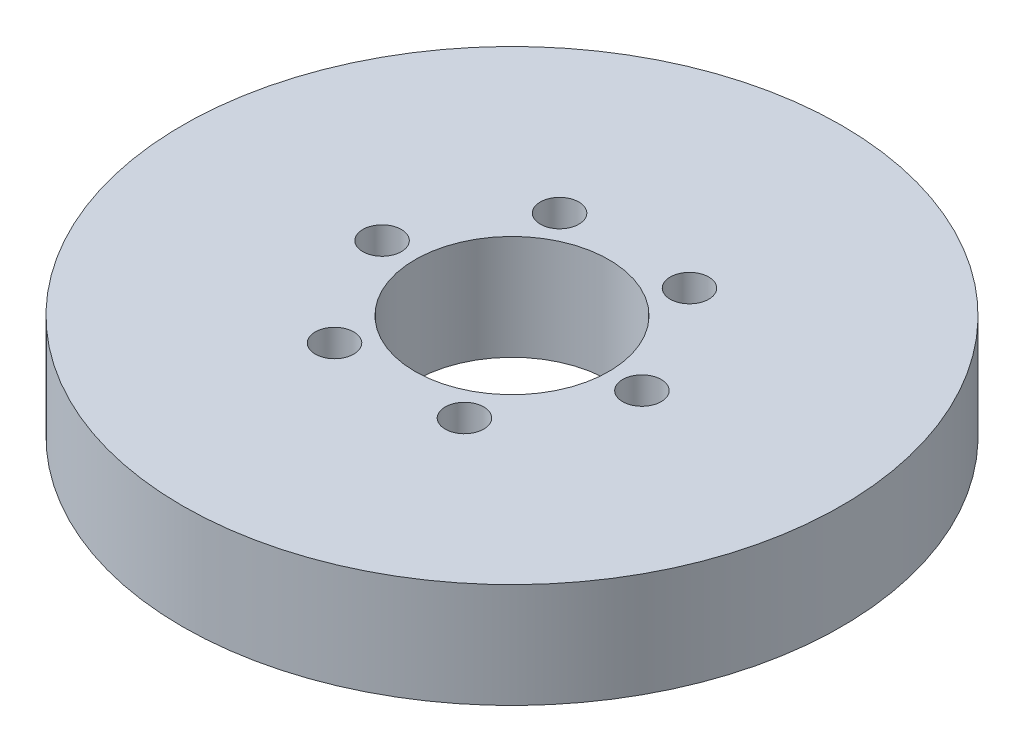
from build123d import *

# Parameters (mm, degrees)
SKETCH1_R           = 85
BOSS_EXTRUDE1_DEPTH = 27
SKETCH2_R           = 25
CUT_EXTRUDE1_DEPTH  = 124.203084377
SKETCH3_R           = 4.973751526
CUT_EXTRUDE2_DEPTH  = 23.202423821
CIRPATTERN1_COUNT   = 6


with BuildPart() as part:
    # Sketch1 → Boss-Extrude1 (new body)
    with BuildSketch(Plane(origin=(0, 0, 0), x_dir=(1, 0, 0), z_dir=(0, 1, 0))):
        Circle(SKETCH1_R)
    extrude(amount=BOSS_EXTRUDE1_DEPTH)

    # Sketch2 → Cut-Extrude1 (cut, through all)
    with BuildSketch(Plane(origin=(0, 0, 0), x_dir=(1, 0, 0), z_dir=(0, 1, 0))):
        Circle(SKETCH2_R)
    extrude(amount=CUT_EXTRUDE1_DEPTH, mode=Mode.SUBTRACT)

    # Sketch3 → Cut-Extrude2 (cut)
    with BuildSketch(Plane(origin=(0, 27, 0), x_dir=(1, 0, 0), z_dir=(0, 1, 0))):
        with Locations((-33.510113522, 0)):
            Circle(SKETCH3_R)
    cut_extrude2 = extrude(amount=-CUT_EXTRUDE2_DEPTH, mode=Mode.SUBTRACT)

    # CirPattern1: Cut-Extrude2 ×6 about axis
    cirpattern1_axis = Axis((0, 0, 0), (0, 1, 0))
    for i in range(1, CIRPATTERN1_COUNT):
        add(cut_extrude2.rotate(cirpattern1_axis, i * 360 / CIRPATTERN1_COUNT), mode=Mode.SUBTRACT)


solid = part.part
